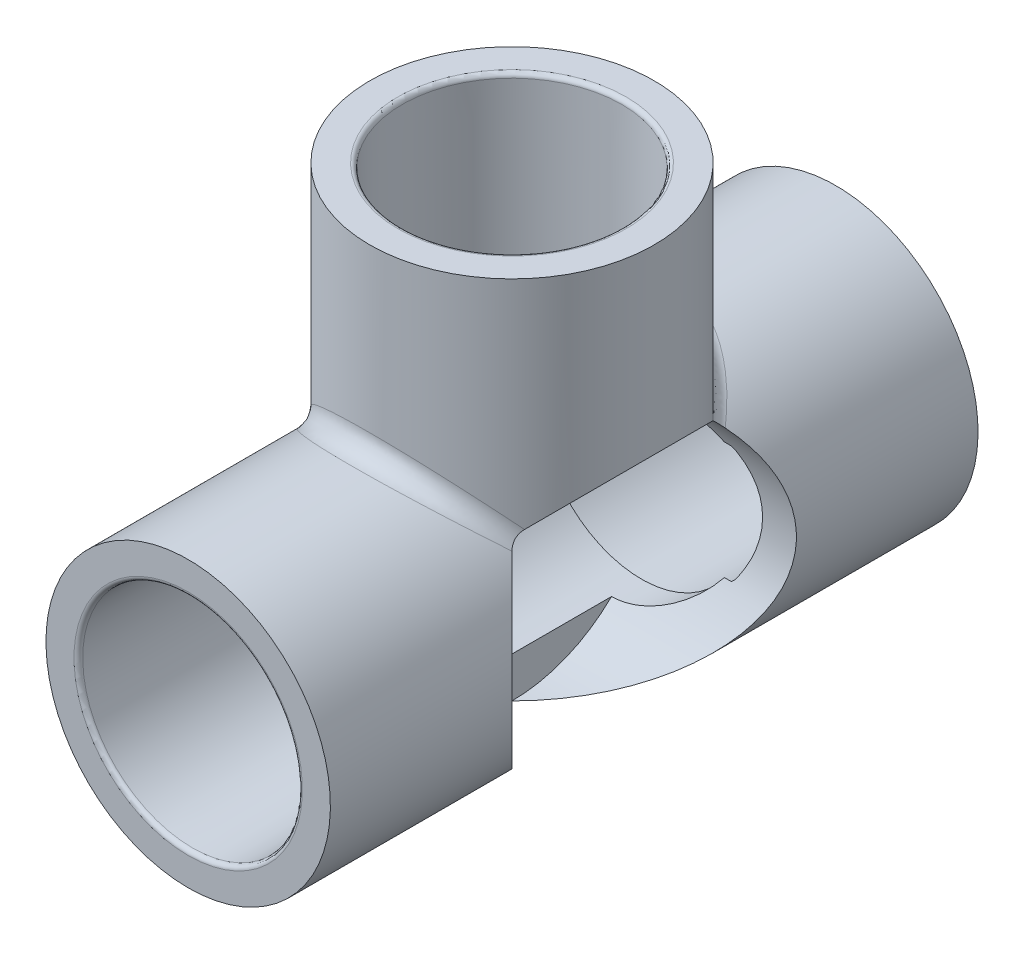
from build123d import *

# Parameters (mm, degrees)
SKETCH3_W          = 63.5
SKETCH3_H          = 13.9446
SKETCH4_W          = 13.9446
SKETCH4_H          = 31.75
FILLET1_R          = 0.161925
FILLET2_R          = 0.430784
FILLET3_R          = 1.853565
SKETCH8_R          = 13.9446
CUT_EXTRUDE1_DEPTH = 17.78


with BuildPart() as part:
    # Sketch3 → Revolve1 (revolve)
    with BuildSketch(Plane(origin=(0, 0, 0), x_dir=(0, 0, -1), z_dir=(1, 0, 0))):
        with Locations((0, -6.9723)):
            Rectangle(SKETCH3_W, SKETCH3_H)
    revolve(axis=Axis((0, 0, 31.75), (0, 0, -1)))

    # Sketch4 → Revolve2 (revolve)
    with BuildSketch(Plane(origin=(0, 0, 0), x_dir=(0, 0, -1), z_dir=(1, 0, 0)), mode=Mode.PRIVATE) as revolve2_sk:
        with Locations((6.9723, 15.875)):
            Rectangle(SKETCH4_W, SKETCH4_H)
    revolve(revolve2_sk.sketch.rotate(Axis((0, 31.75, 0), (0, -1, 0)), 180), axis=Axis((0, 31.75, 0), (0, -1, 0)))

    # Sketch5 → Cut-Revolve1 (revolve, cut)
    with BuildSketch(Plane(origin=(0, 0, 0), x_dir=(0, 0, -1), z_dir=(1, 0, 0))):
        Polygon((-12.7, -9.9568), (12.7, -9.9568), (12.7, -10.6172), (31.75, -10.7696), (31.75, 0), (-31.75, 0), (-31.75, -10.7696), (-12.7, -10.6172), align=None)
    revolve(axis=Axis((0, 0, 31.75), (0, 0, -1)), mode=Mode.SUBTRACT)

    # Sketch6 → Cut-Revolve2 (revolve, cut)
    with BuildSketch(Plane(origin=(0, 0, 0), x_dir=(0, 0, -1), z_dir=(1, 0, 0))):
        Polygon((9.9695, 0), (9.9695, 12.7), (10.6172, 12.7), (10.7696, 31.75), (0, 31.75), (0, 0), align=None)
    revolve(axis=Axis((0, 0, 0), (0, 1, 0)), mode=Mode.SUBTRACT)

    # Fillet1
    fillet1_edges = [part.edges().sort_by_distance(p)[0] for p in [
        (0, 10.6172, 12.7),
        (0, 10.6172, -12.7),
        (0, 12.7, 10.6172),
    ]]
    fillet(fillet1_edges, radius=FILLET1_R)

    # Fillet2
    fillet2_edges = [part.edges().sort_by_distance(p)[0] for p in [
        (0, 10.7696, 31.75),
        (0, 10.7696, -31.75),
        (0, 31.75, 10.7696),
    ]]
    fillet(fillet2_edges, radius=FILLET2_R)

    # Fillet3
    fillet3_edges = [part.edges().sort_by_distance(p)[0] for p in [
        (10.643857585, 9.008893654, 9.008893654),
        (-1.5516e-05, 13.9446, -13.9446),
    ]]
    fillet(fillet3_edges, radius=FILLET3_R)

    # Sketch8 → Cut-Extrude1 (cut)
    with BuildSketch(Plane(origin=(0, 0, 0), x_dir=(0, 0, -1), z_dir=(1, 0, 0))):
        Circle(SKETCH8_R)
    extrude(amount=CUT_EXTRUDE1_DEPTH, mode=Mode.SUBTRACT)


solid = part.part
